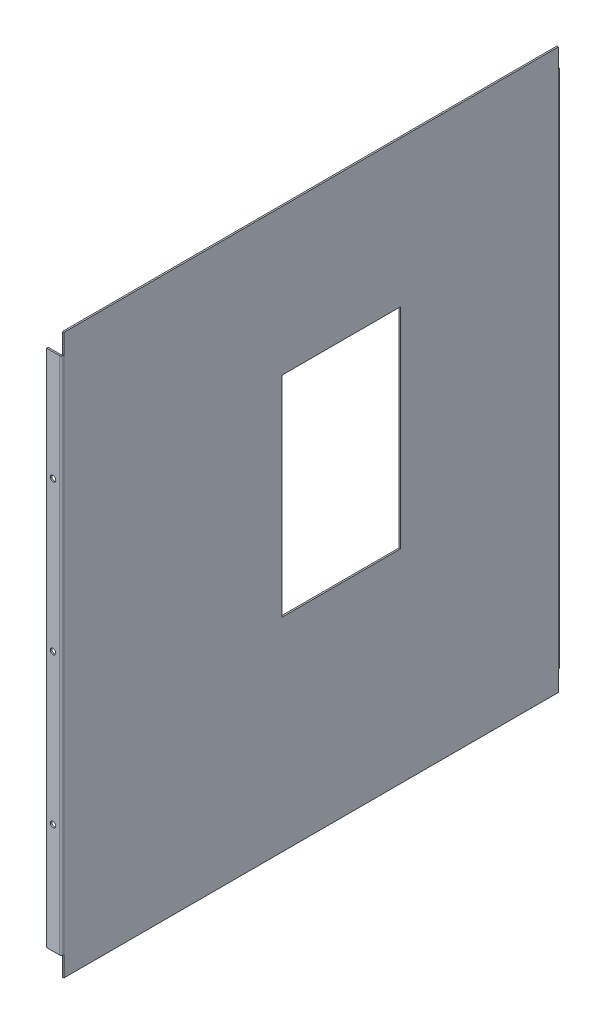
from build123d import *

# Parameters (mm, degrees)
SKETCH_1_W                       = 1.5
SKETCH_1_H                       = 560.17
SM_BASE_FLANGE_1_DEPTH           = 500
SKETCH_6_W                       = 317.570371398
SKETCH_6_H                       = 336.908787646
CUT_EXTRUDE_1_DEPTH              = 10
SKETCH_7_W                       = 1.5
SKETCH_7_H                       = 317.570371398
EXTRUDE_1_DEPTH                  = 34.77
SKETCH_8_W                       = 1.5
SKETCH_8_H                       = 317.570371398
EXTRUDE_2_DEPTH                  = 92.14
SKETCH_9_W                       = 1.5
SKETCH_9_H                       = 209.998787646
EXTRUDE_3_DEPTH                  = 126
SKETCH_10_W                      = 1.5
SKETCH_10_H                      = 209.998787646
EXTRUDE_4_DEPTH                  = 73
SM_EDGE_FLANGE_1_STRIP_W         = 7.4732
SM_EDGE_FLANGE_1_STRIP_H         = 1.5
SM_EDGE_FLANGE_1_STRIP_CUT_DEPTH = 560.17
SM_EDGE_FLANGE_1_DEPTH           = 560.17
SM_EDGE_FLANGE_2_STRIP_W         = 7.4732
SM_EDGE_FLANGE_2_STRIP_H         = 1.5
SM_EDGE_FLANGE_2_STRIP_CUT_DEPTH = 560.17
SM_EDGE_FLANGE_2_DEPTH           = 560.17
SKETCH_19_W                      = 22.446307896
SKETCH_19_H                      = 4.345643328
SKETCH_19_H_2                    = 10.457116237
CUT_EXTRUDE_2_DEPTH              = 20
SKETCH_20_W                      = 19.209439619
SKETCH_20_H                      = 11.495536561
SKETCH_20_W_2                    = 27.208670792
SKETCH_20_H_2                    = 7.195465163
CUT_EXTRUDE_3_DEPTH              = 20
SKETCH_21_R                      = 2.75
CUT_EXTRUDE_4_DEPTH              = 20
CUT_EXTRUDE_START                = -10
SKETCH_22_R                      = 2.75
CUT_EXTRUDE_5_DEPTH              = 10


# Sheet-metal steps are written as plain solids
with BuildPart() as part:
    # Sketch 1 → 基体-法兰1 (new body)
    with BuildSketch(Plane.XY):
        with Locations((0.75, 280.085)):
            Rectangle(SKETCH_1_W, SKETCH_1_H)
    extrude(amount=SM_BASE_FLANGE_1_DEPTH)

    # 草图6 → 切除-拉伸1 (cut)
    with BuildSketch(Plane(origin=(1.5, 0, 0), x_dir=(0, 0, -1), z_dir=(1, 0, 0))):
        with Locations((-246.249491055, 280.085)):
            Rectangle(SKETCH_6_W, SKETCH_6_H)
    extrude(amount=-CUT_EXTRUDE_1_DEPTH, mode=Mode.SUBTRACT)

    # 草图7 → 凸台-拉伸1 (add)
    with BuildSketch(Plane.XZ.offset(-448.539393823)):
        with Locations((0.75, 246.249491055)):
            Rectangle(SKETCH_7_W, SKETCH_7_H)
    extrude(amount=EXTRUDE_1_DEPTH)

    # 草图8 → 凸台-拉伸2 (add)
    with BuildSketch(Plane(origin=(0, 111.630606177, 0), x_dir=(1, 0, 0), z_dir=(0, 1, 0))):
        with Locations((0.75, -246.249491055)):
            Rectangle(SKETCH_8_W, SKETCH_8_H)
    extrude(amount=EXTRUDE_2_DEPTH)

    # 草图9 → 凸台-拉伸3 (add)
    with BuildSketch(Plane(origin=(0, 0, 405.034676754), x_dir=(-1, 0, 0), z_dir=(0, 0, -1))):
        with Locations((-0.75, 308.77)):
            Rectangle(SKETCH_9_W, SKETCH_9_H)
    extrude(amount=EXTRUDE_3_DEPTH)

    # 草图10 → 凸台-拉伸4 (add)
    with BuildSketch(Plane.XY.offset(87.464305356)):
        with Locations((0.75, 308.77)):
            Rectangle(SKETCH_10_W, SKETCH_10_H)
    extrude(amount=EXTRUDE_4_DEPTH)

    # 边线-法兰1 strip (across the edge) → 边线-法兰1 strip cut (cut)
    with BuildSketch(Plane(origin=(0, 0, 500), x_dir=(0, 0, -1), z_dir=(0, 1, 0))):
        with Locations((-1.5, -0.75)):
            Rectangle(SM_EDGE_FLANGE_1_STRIP_W, SM_EDGE_FLANGE_1_STRIP_H)
    extrude(amount=SM_EDGE_FLANGE_1_STRIP_CUT_DEPTH, mode=Mode.SUBTRACT)

    # 边线-法兰1 section (across the edge) → 边线-法兰1 (add)
    with BuildSketch(Plane(origin=(0, 0, 500), x_dir=(0, 0, -1), z_dir=(0, 1, 0))):
        with BuildLine():
            Line((0, 0.7366), (0, 13.5))
            Line((0, 13.5), (1.5, 13.5))
            Line((1.5, 13.5), (1.5, 0.7366))
            ThreePointArc((1.5, 0.7366), (1.715745145, 0.215745145), (2.2366, 0))
            Line((2.2366, 0), (2.2366, -1.5))
            ThreePointArc((2.2366, -1.5), (0.655084973, -0.844915027), (0, 0.7366))
        make_face()
    extrude(amount=SM_EDGE_FLANGE_1_DEPTH)

    # 边线-法兰2 strip (across the edge) → 边线-法兰2 strip cut (cut)
    with BuildSketch(Plane(origin=(0, 560.17, 0), x_dir=(0, 0, 1), z_dir=(0, -1, 0))):
        with Locations((-1.5, -0.75)):
            Rectangle(SM_EDGE_FLANGE_2_STRIP_W, SM_EDGE_FLANGE_2_STRIP_H)
    extrude(amount=SM_EDGE_FLANGE_2_STRIP_CUT_DEPTH, mode=Mode.SUBTRACT)

    # 边线-法兰2 section (across the edge) → 边线-法兰2 (add)
    with BuildSketch(Plane(origin=(0, 560.17, 0), x_dir=(0, 0, 1), z_dir=(0, -1, 0))):
        with BuildLine():
            Line((0, 0.7366), (0, 13.5))
            Line((0, 13.5), (1.5, 13.5))
            Line((1.5, 13.5), (1.5, 0.7366))
            ThreePointArc((1.5, 0.7366), (1.715745145, 0.215745145), (2.2366, 0))
            Line((2.2366, 0), (2.2366, -1.5))
            ThreePointArc((2.2366, -1.5), (0.655084973, -0.844915027), (0, 0.7366))
        make_face()
    extrude(amount=SM_EDGE_FLANGE_2_DEPTH)

    # 草图19 → 切除-拉伸2 (cut)
    with BuildSketch(Plane.XZ):
        with Locations((-9.723153948, 0.063778336)):
            Rectangle(SKETCH_19_W, SKETCH_19_H)
        with Locations((-9.723153948, 502.991958119)):
            Rectangle(SKETCH_19_W, SKETCH_19_H_2)
    extrude(amount=-CUT_EXTRUDE_2_DEPTH, mode=Mode.SUBTRACT)

    # 草图20 → 切除-拉伸3 (cut)
    with BuildSketch(Plane(origin=(0, 560.17, 0), x_dir=(1, 0, 0), z_dir=(0, 1, 0))):
        with Locations((-8.10471981, -503.511168281)):
            Rectangle(SKETCH_20_W, SKETCH_20_H)
        with Locations((-12.104335396, 1.361132582)):
            Rectangle(SKETCH_20_W_2, SKETCH_20_H_2)
    extrude(amount=-CUT_EXTRUDE_3_DEPTH, mode=Mode.SUBTRACT)

    # 草图21 → 切除-拉伸4 (cut)
    with BuildSketch(Plane.XY.offset(1.5)):
        with Locations((-7.1183, 430.085)):
            Circle(SKETCH_21_R)
        with Locations((-7.1183, 280.085)):
            Circle(SKETCH_21_R)
        with Locations(Location((-7.1183, 130.085, 0), (0, 0, 180))):
            Circle(SKETCH_21_R)
    extrude(amount=-CUT_EXTRUDE_4_DEPTH, mode=Mode.SUBTRACT)

    # 草图22 → 切除-拉伸5 (cut)
    with BuildSketch(Plane(origin=(0, 0, 498.5), x_dir=(-1, 0, 0), z_dir=(0, 0, -1)).offset(CUT_EXTRUDE_START)):
        with Locations(Location((7.1183, 430.085, 0), (0, 0, 180))):
            Circle(SKETCH_22_R)
        with Locations(Location((7.1183, 280.085, 0), (0, 0, 180))):
            Circle(SKETCH_22_R)
        with Locations((7.1183, 130.085)):
            Circle(SKETCH_22_R)
    extrude(amount=CUT_EXTRUDE_5_DEPTH, mode=Mode.SUBTRACT)


solid = part.part
